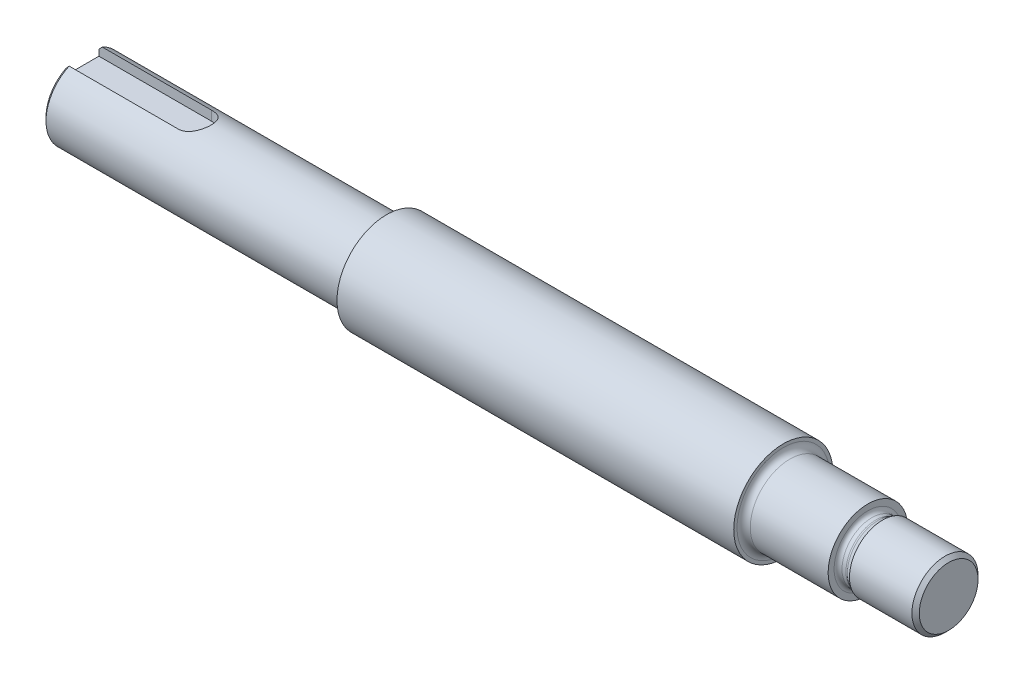
from build123d import *

# Parameters (mm, degrees)
FILLET1_R          = 1
CHAMFER2_SIZE      = 0.5
CUT_EXTRUDE1_START = 4
CUT_EXTRUDE1_DEPTH = 128.428687888


# Read off the part's stored shape, not the designer's step: M10x1.0 Machine Threads Stud1
with BuildPart() as part:
    # Sketch1 → Revolve1 (revolve)
    with BuildSketch(Plane(origin=(0, 0, 0), x_dir=(1, 0, 0), z_dir=(0, 1, 0))):
        Polygon((0, 0), (0, -6), (46, -6), (46, -7.5), (106, -7.5), (106, -6), (131, -6), (131, 0), align=None)
    revolve(axis=Axis((0, 0, 0), (1, 0, 0)))

    # Fillet1
    fillet1_edges = [part.edges().sort_by_distance(p)[0] for p in [
        (106, 0, -6),
        (46, 0, -6),
    ]]
    fillet(fillet1_edges, radius=FILLET1_R)

    # M10x1.0 Machine Threads Stud1 outline → M10x1.0 Machine Threads Stud1 (revolve, cut)
    with BuildSketch(Plane.YX):
        with BuildLine():
            Line((6, 131), (4.4455, 131))
            Line((4.4455, 131), (5, 130.4455))
            Line((5, 130.4455), (5, 121))
            Line((5, 121), (4.580384758, 120.273205081))
            ThreePointArc((4.580384758, 120.273205081), (4.520444504, 120.128496508), (4.5, 119.973205081))
            Line((4.5, 119.973205081), (4.5, 119.373205081))
            ThreePointArc((4.5, 119.373205081), (4.675735931, 118.948941012), (5.1, 118.773205081))
            Line((5.1, 118.773205081), (6, 118.773205081))
            Line((6, 118.773205081), (6, 131))
        make_face()
    revolve(axis=Axis((0, 0, 0), (1, 0, 0)), mode=Mode.SUBTRACT)

    # Chamfer2
    chamfer2_edges = [part.edges().sort_by_distance(p)[0] for p in [
        (0, 0, -6),
    ]]
    chamfer(chamfer2_edges, length=CHAMFER2_SIZE)

    # Sketch3 → Cut-Extrude1 (cut, through all)
    with BuildSketch(Plane(origin=(0, 0, 0), x_dir=(1, 0, 0), z_dir=(0, 1, 0)).offset(CUT_EXTRUDE1_START)):
        with BuildLine():
            Line((-17, -2.5), (17, -2.5))
            ThreePointArc((17, -2.5), (19.5, 0), (17, 2.5))
            Line((17, 2.5), (-17, 2.5))
            Line((-17, 2.5), (-17, -2.5))
        make_face()
    extrude(amount=CUT_EXTRUDE1_DEPTH, mode=Mode.SUBTRACT)


solid = part.part
